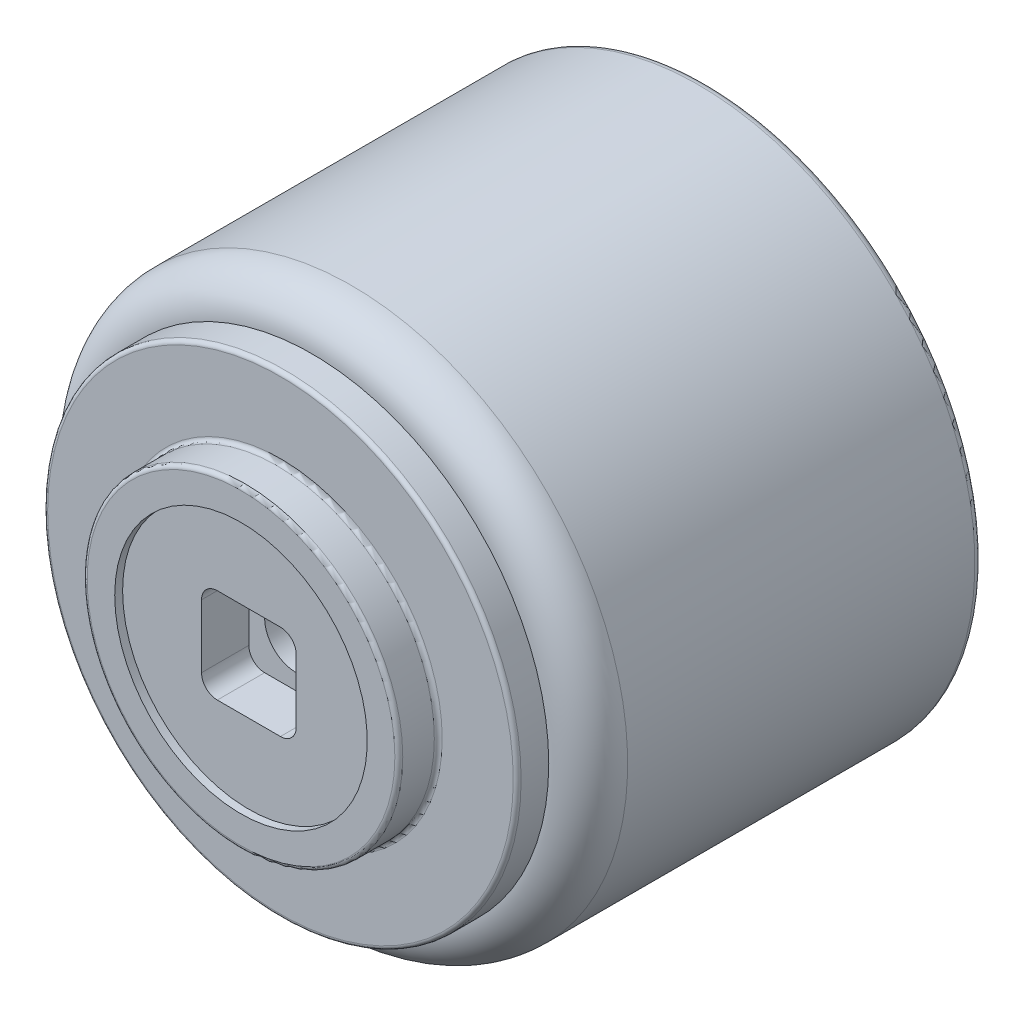
from build123d import *

# Parameters (mm, degrees)
SKETCH2_R                    = 20
BOSS_EXTRUDE1_DEPTH          = 5
SKETCH3_W                    = 12
SKETCH3_H                    = 12
CUT_EXTRUDE1_DEPTH           = 7
M45_CLEARANCE_HOLE1_D        = 50
M45_CLEARANCE_HOLE1_DEPTH    = 3
SKETCH6_W                    = 12.5
SKETCH6_H                    = 2
SKETCH7_W                    = 16
SKETCH7_H                    = 1
F_8_0_8_DIAMETER_HOLE1_D     = 8
F_8_0_8_DIAMETER_HOLE1_DEPTH = 52
FILLET1_R                    = 0.5
FILLET2_R                    = 1
FILLET3_R                    = 2


with BuildPart() as part:
    # Sketch1 → Revolve1 (revolve)
    with BuildSketch(Plane.XZ):
        with BuildLine():
            Line((30, 54), (0, 54))
            Line((0, 54), (0, 0))
            Line((0, 0), (35, 0))
            Line((35, 0), (35, 45))
            ThreePointArc((35, 45), (33.535533906, 48.535533906), (30, 50))
            Line((30, 50), (30, 54))
        make_face()
    revolve(axis=Axis((0, 0, 54), (0, 0, -1)))

    # Sketch2 → Boss-Extrude1 (add)
    with BuildSketch(Plane.XY.offset(54)):
        Circle(SKETCH2_R)
    extrude(amount=BOSS_EXTRUDE1_DEPTH)

    # Sketch3 → Cut-Extrude1 (cut)
    with BuildSketch(Plane.XY.offset(59)):
        Rectangle(SKETCH3_W, SKETCH3_H)
    extrude(amount=-CUT_EXTRUDE1_DEPTH, mode=Mode.SUBTRACT)

    # M45 Clearance Hole1
    with Locations(Plane(origin=(0, 0, 0), x_dir=(-1, 0, 0), z_dir=(0, 0, -1))):
        with Locations((0, 0)):
            Hole(M45_CLEARANCE_HOLE1_D / 2, depth=M45_CLEARANCE_HOLE1_DEPTH)

    # Sketch6 → Revolve2 (revolve)
    with BuildSketch(Plane(origin=(0, 0, 0), x_dir=(1, 0, 0), z_dir=(0, 1, 0))):
        with Locations((6.25, -2)):
            Rectangle(SKETCH6_W, SKETCH6_H)
    revolve(axis=Axis((0, 0, 1), (0, 0, 1)))

    # Sketch7 → Cut-Revolve1 (revolve, cut)
    with BuildSketch(Plane(origin=(0, 0, 0), x_dir=(1, 0, 0), z_dir=(0, 1, 0))):
        with Locations((-8, -58.5)):
            Rectangle(SKETCH7_W, SKETCH7_H)
    revolve(axis=Axis((0, 0, 59), (0, 0, -1)), mode=Mode.SUBTRACT)

    # Ø8.0 (8) Diameter Hole1
    with Locations(Plane.XY.offset(52)):
        with Locations((0, 0)):
            Hole(F_8_0_8_DIAMETER_HOLE1_D / 2, depth=F_8_0_8_DIAMETER_HOLE1_DEPTH)

    # Fillet1
    fillet1_edges = [part.edges().sort_by_distance(p)[0] for p in [
        (-30, 0, 54),
        (-12.5, 0, 1),
        (-25, 0, 0),
        (-20, 0, 54),
        (-25, 0, 3),
        (-20, 0, 59),
        (-12.5, 0, 3),
    ]]
    fillet(fillet1_edges, radius=FILLET1_R)

    # Fillet2
    fillet2_edges = [part.edges().sort_by_distance(p)[0] for p in [
        (-35, 0, 0),
    ]]
    fillet(fillet2_edges, radius=FILLET2_R)

    # Fillet3
    fillet3_edges = [part.edges().sort_by_distance(p)[0] for p in [
        (-6, -6, 55),
        (6, -6, 55),
        (-6, 6, 55),
        (6, 6, 55),
    ]]
    fillet(fillet3_edges, radius=FILLET3_R)


solid = part.part
